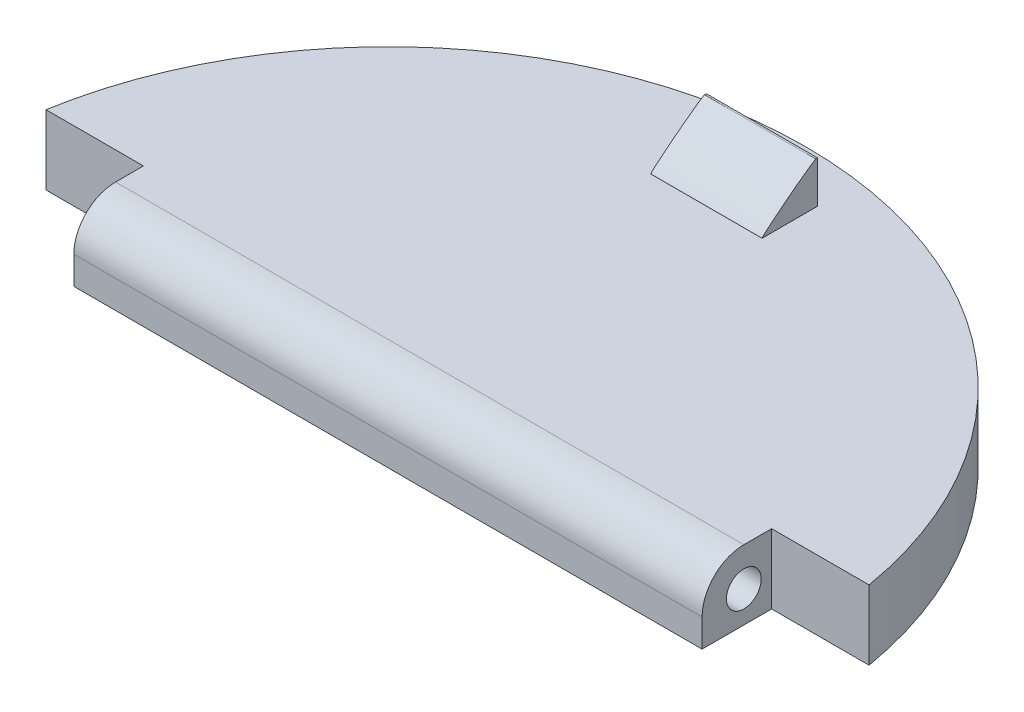
from build123d import *

# Parameters (mm, degrees)
BOSS_EXTRUDE1_DEPTH = 5
SKETCH3_W           = 8
SKETCH3_H           = 4
BOSS_EXTRUDE2_DEPTH = 3
FILLET1_START       = -3.841593316
FILLET1_DEPTH       = 8
CUT_EXTRUDE1_START  = -10
CUT_EXTRUDE1_DEPTH  = 10
FILLET2_R           = 3
SKETCH6_R           = 1.25
CUT_EXTRUDE2_DEPTH  = 5
CUT_EXTRUDE3_START  = -5
SKETCH7_R           = 1.25
CUT_EXTRUDE3_DEPTH  = 5


with BuildPart() as part:
    # Sketch1 → Boss-Extrude1 (new body)
    with BuildSketch(Plane(origin=(0, 0, 0), x_dir=(1, 0, 0), z_dir=(0, 1, 0))):
        with BuildLine():
            Line((-30, 0), (30, 0))
            ThreePointArc((30, 0), (0, 30), (-30, 0))
        make_face()
    extrude(amount=BOSS_EXTRUDE1_DEPTH)

    # Sketch3 → Boss-Extrude2 (add)
    with BuildSketch(Plane(origin=(0, 5, 0), x_dir=(1, 0, 0), z_dir=(0, 1, 0))):
        with Locations((0.158406684, 24.731666579)):
            Rectangle(SKETCH3_W, SKETCH3_H)
    extrude(amount=BOSS_EXTRUDE2_DEPTH)

    # Fillet1: read off the stored shape, not the designer's step
    # Fillet1 outline → Fillet1 (cut)
    with BuildSketch(Plane.YZ.offset(FILLET1_START)):
        with BuildLine():
            Line((8, -22.731666579), (5, -22.731666579))
            add(Edge.make_bspline(
                [(5, -22.731666579), (8, -23.506263249), (8, -26.604649926)],
                knots=[0, 0, 0, 1, 1, 1], degree=2, weights=[1, 0.057495957, 1]))
            Line((8, -26.604649926), (8, -22.731666579))
        make_face()
    extrude(amount=FILLET1_DEPTH, mode=Mode.SUBTRACT)

    # Sketch5 → Cut-Extrude1 (cut)
    with BuildSketch(Plane(origin=(0, 5, 0), x_dir=(1, 0, 0), z_dir=(0, 1, 0)).offset(CUT_EXTRUDE1_START)):
        with BuildLine():
            Line((-22.580398915, 0), (-22.580398915, 5))
            Line((-22.580398915, 5), (-29.580398915, 5))
            ThreePointArc((-29.580398915, 5), (-29.894915684, 2.508787808), (-30, 0))
            Line((-30, 0), (-22.580398915, 0))
        make_face()
        with BuildLine():
            Line((22.580398915, 5), (29.580398915, 5))
            ThreePointArc((29.580398915, 5), (29.894915684, 2.508787808), (30, 0))
            Line((30, 0), (22.580398915, 0))
            Line((22.580398915, 0), (22.580398915, 5))
        make_face()
    extrude(amount=CUT_EXTRUDE1_DEPTH, mode=Mode.SUBTRACT)

    # Fillet2
    fillet2_edges = [part.edges().sort_by_distance(p)[0] for p in [
        (0, 5, 0),
    ]]
    fillet(fillet2_edges, radius=FILLET2_R)

    # Sketch6 → Cut-Extrude2 (cut)
    with BuildSketch(Plane(origin=(22.580398915, 0, 0), x_dir=(0, 0, -1), z_dir=(1, 0, 0))):
        with Locations((3, 2.25)):
            Circle(SKETCH6_R)
    extrude(amount=-CUT_EXTRUDE2_DEPTH, mode=Mode.SUBTRACT)

    # Sketch7 → Cut-Extrude3 (cut)
    with BuildSketch(Plane.ZY.offset(22.580398915).offset(CUT_EXTRUDE3_START)):
        with Locations(Location((-3, 2.25, 0), (0, 0, 180))):
            Circle(SKETCH7_R)
    extrude(amount=CUT_EXTRUDE3_DEPTH, mode=Mode.SUBTRACT)


solid = part.part
